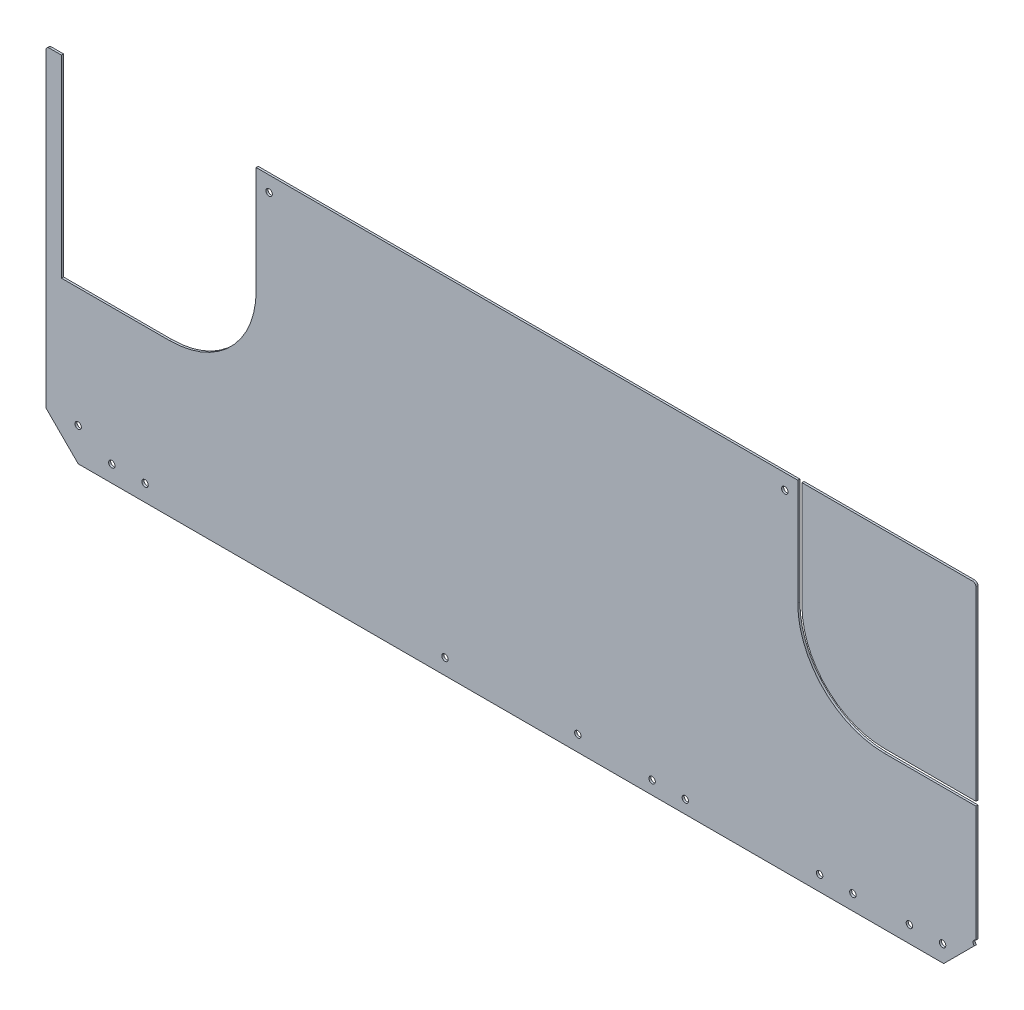
from build123d import *

# Parameters (mm, degrees)
SKETCH3_W                              = 914.4
SKETCH3_H                              = 609.6
BOSS_EXTRUDE1_DEPTH                    = 0.79375
SKETCH4_OUTSIDE_W                      = 1136.194
SKETCH4_OUTSIDE_H                      = 831.394
CUT_EXTRUDE1_DEPTH                     = 2.54
CUT_EXTRUDE2_DEPTH                     = 2.54
CUT_EXTRUDE3_DEPTH                     = 2.54
SKETCH11_W                             = 2.45745
SKETCH11_H                             = 1.5875
F_10_0_1935_DIAMETER_HOLE1_AT_2_COUNT  = 2
F_10_0_1935_DIAMETER_HOLE1_AT_2_PITCH  = 25.4
F_10_0_1935_DIAMETER_HOLE1_AT_3_COUNT  = 2
F_10_0_1935_DIAMETER_HOLE1_AT_3_PITCH  = 52.708494186
F_10_0_1935_DIAMETER_HOLE1_AT_4_COUNT  = 2
F_10_0_1935_DIAMETER_HOLE1_AT_4_PITCH  = 609.955600508
F_10_0_1935_DIAMETER_HOLE1_AT_5_COUNT  = 2
F_10_0_1935_DIAMETER_HOLE1_AT_5_PITCH  = 584.555600508
F_10_0_1935_DIAMETER_HOLE1_AT_6_COUNT  = 2
F_10_0_1935_DIAMETER_HOLE1_AT_6_PITCH  = 635.838045264
F_10_0_1935_DIAMETER_HOLE1_AT_7_COUNT  = 2
F_10_0_1935_DIAMETER_HOLE1_AT_7_PITCH  = 545.026051512
F_10_0_1935_DIAMETER_HOLE1_AT_8_COUNT  = 2
F_10_0_1935_DIAMETER_HOLE1_AT_8_PITCH  = 258.142956966
F_10_0_1935_DIAMETER_HOLE1_AT_9_COUNT  = 2
F_10_0_1935_DIAMETER_HOLE1_AT_9_PITCH  = 387.799729888
F_10_0_1935_DIAMETER_HOLE1_AT_10_COUNT = 2
F_10_0_1935_DIAMETER_HOLE1_AT_10_PITCH = 413.19915925
F_10_0_1935_DIAMETER_HOLE1_AT_11_COUNT = 2
F_10_0_1935_DIAMETER_HOLE1_AT_11_PITCH = 515.935593864
F_10_0_1935_DIAMETER_HOLE1_AT_12_COUNT = 2
F_10_0_1935_DIAMETER_HOLE1_AT_12_PITCH = 541.335539269
F_10_0_1935_DIAMETER_HOLE1_AT_13_COUNT = 2
F_10_0_1935_DIAMETER_HOLE1_AT_13_PITCH = 229.406754795
F_10_0_1935_DIAMETER_HOLE1_AT_14_COUNT = 2
F_10_0_1935_DIAMETER_HOLE1_AT_14_PITCH = 331.006388617


with BuildPart() as part:
    # Sketch3 → Boss-Extrude1 (new, symmetric)
    with BuildSketch(Plane.XY):
        Rectangle(SKETCH3_W, SKETCH3_H)
    extrude(amount=BOSS_EXTRUDE1_DEPTH, both=True)

    # Sketch4 outside → Cut-Extrude1 (cut)
    with BuildSketch(Plane.XY.offset(0.79375)):
        Rectangle(SKETCH4_OUTSIDE_W, SKETCH4_OUTSIDE_H)
        with BuildLine():
            Line((-364.741176915, -305.554584202), (-390.141176915, -280.154584202))
            Line((-390.141176915, -280.154584202), (-390.141176915, -42.982084202))
            ThreePointArc((-390.141176915, -42.982084202), (-389.397228139, -41.186032978), (-387.601176915, -40.442084202))
            Line((-387.601176915, -40.442084202), (318.518823085, -40.442084202))
            ThreePointArc((318.518823085, -40.442084202), (320.314874309, -41.186032978), (321.058823085, -42.982084202))
            Line((321.058823085, -42.982084202), (321.058823085, -280.154584202))
            Line((321.058823085, -280.154584202), (295.658823085, -305.554584202))
            Line((295.658823085, -305.554584202), (-364.741176915, -305.554584202))
        make_face(mode=Mode.SUBTRACT)
    extrude(amount=-CUT_EXTRUDE1_DEPTH, mode=Mode.SUBTRACT)

    # Sketch7 → Cut-Extrude2 (cut)
    with BuildSketch(Plane.XY.offset(0.79375)):
        with BuildLine():
            Line((-378.246738216, -188.190344021), (-378.246738216, -39.346344021))
            Line((-378.246738216, -39.346344021), (-229.402738216, -39.346344021))
            Line((-229.402738216, -39.346344021), (-229.402738216, -64.746344021))
            Line((-229.402738216, -64.746344021), (-229.402738216, -121.896344021))
            ThreePointArc((-229.402738216, -121.896344021), (-248.819801264, -168.773280973), (-295.696738216, -188.190344021))
            Line((-295.696738216, -188.190344021), (-352.846738216, -188.190344021))
            Line((-352.846738216, -188.190344021), (-378.246738216, -188.190344021))
        make_face()
    extrude(amount=-CUT_EXTRUDE2_DEPTH, mode=Mode.SUBTRACT)

    # Sketch8 → Cut-Extrude3 (cut)
    with BuildSketch(Plane.XY.offset(0.79375)):
        with BuildLine():
            Line((251.115061771, -188.190344021), (336.840061771, -188.190344021))
            Line((336.840061771, -188.190344021), (336.840061771, -36.171344021))
            Line((336.840061771, -36.171344021), (184.821061771, -36.171344021))
            Line((184.821061771, -36.171344021), (184.821061771, -121.896344021))
            ThreePointArc((184.821061771, -121.896344021), (204.238124819, -168.773280973), (251.115061771, -188.190344021))
        make_face()
        with BuildLine():
            Line((251.115061771, -185.015344021), (333.665061771, -185.015344021))
            Line((333.665061771, -185.015344021), (333.665061771, -39.346344021))
            Line((333.665061771, -39.346344021), (187.996061771, -39.346344021))
            Line((187.996061771, -39.346344021), (187.996061771, -121.896344021))
            ThreePointArc((187.996061771, -121.896344021), (206.483188849, -166.528216943), (251.115061771, -185.015344021))
        make_face(mode=Mode.SUBTRACT)
    extrude(amount=-CUT_EXTRUDE3_DEPTH, mode=Mode.SUBTRACT)


with BuildPart() as cut_extrude3_piece_1:
    # of the separate pieces the step leaves, piece 1, a body of its own (cut_extrude3_pieces)
    add(part.part.solids().sort_by_distance((296.413407287, -304.8, -0.79375))[0])

    # Sketch11 → #10 (0.1935) Diameter Hole1 (revolve, cut)
    with BuildSketch(Plane(origin=(-314.391138724, -292.114748821, 0.79375), x_dir=(0, -1, 0), z_dir=(1, 0, 0))):
        with Locations((1.228725, 0.79375)):
            Rectangle(SKETCH11_W, SKETCH11_H)
    f_10_0_1935_diameter_hole1 = revolve(axis=Axis((-314.391138724, -292.114748821, 7.14375), (0, 0, -1)), mode=Mode.SUBTRACT)

    # #10 (0.1935) Diameter Hole1 at 2: #10 (0.1935) Diameter Hole1 ×2
    with Locations(*[(-i * F_10_0_1935_DIAMETER_HOLE1_AT_2_PITCH, 0, 0) for i in range(1, F_10_0_1935_DIAMETER_HOLE1_AT_2_COUNT)]):
        add(f_10_0_1935_diameter_hole1, mode=Mode.SUBTRACT)

    # #10 (0.1935) Diameter Hole1 at 3: #10 (0.1935) Diameter Hole1 ×2
    with Locations(*[Vector(-0.9705380561850375, 0.2409478812867402, 0) * (i * F_10_0_1935_DIAMETER_HOLE1_AT_3_PITCH) for i in range(1, F_10_0_1935_DIAMETER_HOLE1_AT_3_COUNT)]):
        add(f_10_0_1935_diameter_hole1, mode=Mode.SUBTRACT)

    # #10 (0.1935) Diameter Hole1 at 4: #10 (0.1935) Diameter Hole1 ×2
    with Locations(*[(i * F_10_0_1935_DIAMETER_HOLE1_AT_4_PITCH, 0, 0) for i in range(1, F_10_0_1935_DIAMETER_HOLE1_AT_4_COUNT)]):
        add(f_10_0_1935_diameter_hole1, mode=Mode.SUBTRACT)

    # #10 (0.1935) Diameter Hole1 at 5: #10 (0.1935) Diameter Hole1 ×2
    with Locations(*[(i * F_10_0_1935_DIAMETER_HOLE1_AT_5_PITCH, 0, 0) for i in range(1, F_10_0_1935_DIAMETER_HOLE1_AT_5_COUNT)]):
        add(f_10_0_1935_diameter_hole1, mode=Mode.SUBTRACT)

    # #10 (0.1935) Diameter Hole1 at 6: #10 (0.1935) Diameter Hole1 ×2
    with Locations(*[Vector(0.9998005069605744, 0.01997363966277868, 0) * (i * F_10_0_1935_DIAMETER_HOLE1_AT_6_PITCH) for i in range(1, F_10_0_1935_DIAMETER_HOLE1_AT_6_COUNT)]):
        add(f_10_0_1935_diameter_hole1, mode=Mode.SUBTRACT)

    # #10 (0.1935) Diameter Hole1 at 7: #10 (0.1935) Diameter Hole1 ×2
    with Locations(*[Vector(0.8977666281056725, 0.44047143092347246, 0) * (i * F_10_0_1935_DIAMETER_HOLE1_AT_7_PITCH) for i in range(1, F_10_0_1935_DIAMETER_HOLE1_AT_7_COUNT)]):
        add(f_10_0_1935_diameter_hole1, mode=Mode.SUBTRACT)

    # #10 (0.1935) Diameter Hole1 at 8: #10 (0.1935) Diameter Hole1 ×2
    with Locations(*[Vector(0.3676040656829352, 0.929982392786754, 0) * (i * F_10_0_1935_DIAMETER_HOLE1_AT_8_PITCH) for i in range(1, F_10_0_1935_DIAMETER_HOLE1_AT_8_COUNT)]):
        add(f_10_0_1935_diameter_hole1, mode=Mode.SUBTRACT)

    # #10 (0.1935) Diameter Hole1 at 9: #10 (0.1935) Diameter Hole1 ×2
    with Locations(*[Vector(0.9999760624722116, -0.006919138860556039, 0) * (i * F_10_0_1935_DIAMETER_HOLE1_AT_9_PITCH) for i in range(1, F_10_0_1935_DIAMETER_HOLE1_AT_9_COUNT)]):
        add(f_10_0_1935_diameter_hole1, mode=Mode.SUBTRACT)

    # #10 (0.1935) Diameter Hole1 at 10: #10 (0.1935) Diameter Hole1 ×2
    with Locations(*[Vector(0.9999789149409217, -0.006493818104694053, 0) * (i * F_10_0_1935_DIAMETER_HOLE1_AT_10_PITCH) for i in range(1, F_10_0_1935_DIAMETER_HOLE1_AT_10_COUNT)]):
        add(f_10_0_1935_diameter_hole1, mode=Mode.SUBTRACT)

    # #10 (0.1935) Diameter Hole1 at 11: #10 (0.1935) Diameter Hole1 ×2
    with Locations(*[Vector(0.9999977447500156, -0.002123792570558621, 0) * (i * F_10_0_1935_DIAMETER_HOLE1_AT_11_PITCH) for i in range(1, F_10_0_1935_DIAMETER_HOLE1_AT_11_COUNT)]):
        add(f_10_0_1935_diameter_hole1, mode=Mode.SUBTRACT)

    # #10 (0.1935) Diameter Hole1 at 12: #10 (0.1935) Diameter Hole1 ×2
    with Locations(*[Vector(0.9999979514218106, -0.00202414233252848, 0) * (i * F_10_0_1935_DIAMETER_HOLE1_AT_12_PITCH) for i in range(1, F_10_0_1935_DIAMETER_HOLE1_AT_12_COUNT)]):
        add(f_10_0_1935_diameter_hole1, mode=Mode.SUBTRACT)

    # #10 (0.1935) Diameter Hole1 at 13: #10 (0.1935) Diameter Hole1 ×2
    with Locations(*[Vector(0.999994799693704, -0.0032249938835533, 0) * (i * F_10_0_1935_DIAMETER_HOLE1_AT_13_PITCH) for i in range(1, F_10_0_1935_DIAMETER_HOLE1_AT_13_COUNT)]):
        add(f_10_0_1935_diameter_hole1, mode=Mode.SUBTRACT)

    # #10 (0.1935) Diameter Hole1 at 14: #10 (0.1935) Diameter Hole1 ×2
    with Locations(*[Vector(0.9999975021406055, -0.0022351090688972762, 0) * (i * F_10_0_1935_DIAMETER_HOLE1_AT_14_PITCH) for i in range(1, F_10_0_1935_DIAMETER_HOLE1_AT_14_COUNT)]):
        add(f_10_0_1935_diameter_hole1, mode=Mode.SUBTRACT)


with BuildPart() as cut_extrude3_piece_2:
    # of the separate pieces the step leaves, piece 2, a body of its own (cut_extrude3_pieces)
    add(part.part.solids().sort_by_distance((321.058823085, -42.982084202, 0.79375))[0])


solid = Compound([cut_extrude3_piece_1.part, cut_extrude3_piece_2.part])
